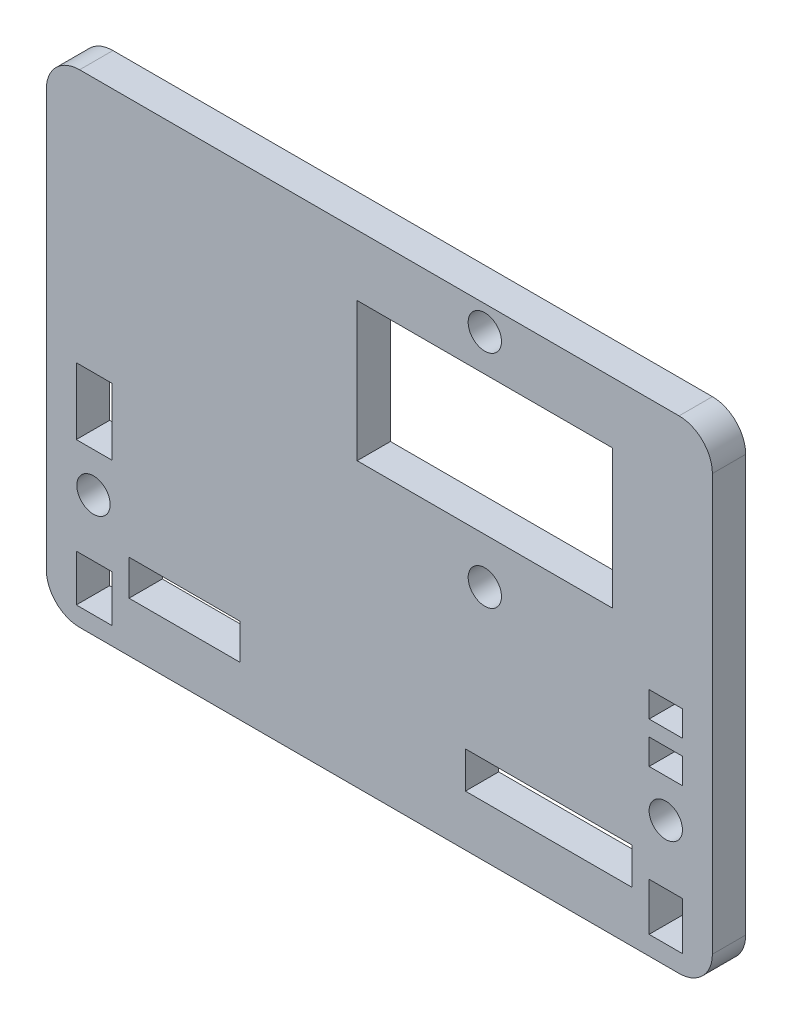
from build123d import *

# Parameters (mm, degrees)
ESQUISSE1_R               = 1.5
ESQUISSE1_W               = 23
ESQUISSE1_H               = 12.5
ESQUISSE1_W_2             = 3.2
ESQUISSE1_H_2             = 6
ESQUISSE1_H_3             = 4.2
ESQUISSE1_W_3             = 10
ESQUISSE1_H_4             = 3.2
ESQUISSE1_W_4             = 15
ESQUISSE1_H_5             = 3.3
ESQUISSE1_W_5             = 3
ESQUISSE1_H_6             = 4.3
ESQUISSE1_H_7             = 2.3
T_LE_DE_BASE_PLI_E1_DEPTH = 3


# Sheet-metal steps are written as plain solids
with BuildPart() as part:
    # Esquisse1 → Tôle de base pliée1 (new body)
    with BuildSketch(Plane.XY):
        with BuildLine():
            Line((-822.16567012, 1708.277520055), (-768.16567012, 1708.277520055))
            ThreePointArc((-768.16567012, 1708.277520055), (-766.044349777, 1707.398840398), (-765.16567012, 1705.277520055))
            Line((-765.16567012, 1705.277520055), (-765.16567012, 1667.777520055))
            ThreePointArc((-765.16567012, 1667.777520055), (-766.044349777, 1665.656199711), (-768.16567012, 1664.777520055))
            Line((-768.16567012, 1664.777520055), (-822.16567012, 1664.777520055))
            ThreePointArc((-822.16567012, 1664.777520055), (-824.286990464, 1665.656199711), (-825.16567012, 1667.777520055))
            Line((-825.16567012, 1667.777520055), (-825.16567012, 1705.277520055))
            ThreePointArc((-825.16567012, 1705.277520055), (-824.286990464, 1707.398840398), (-822.16567012, 1708.277520055))
        make_face()
        with Locations((-785.66567012, 1706.077520055)):
            Circle(ESQUISSE1_R, mode=Mode.SUBTRACT)
        with Locations((-785.66567012, 1686.177520055)):
            Circle(ESQUISSE1_R, mode=Mode.SUBTRACT)
        with Locations((-820.91567012, 1675.727520055)):
            Circle(ESQUISSE1_R, mode=Mode.SUBTRACT)
        with Locations((-769.36567012, 1676.127520055)):
            Circle(ESQUISSE1_R, mode=Mode.SUBTRACT)
        with Locations((-785.66567012, 1696.527520055)):
            Rectangle(ESQUISSE1_W, ESQUISSE1_H, mode=Mode.SUBTRACT)
        with Locations((-820.86567012, 1682.277520055)):
            Rectangle(ESQUISSE1_W_2, ESQUISSE1_H_2, mode=Mode.SUBTRACT)
        with Locations((-820.86567012, 1668.477520055)):
            Rectangle(ESQUISSE1_W_2, ESQUISSE1_H_3, mode=Mode.SUBTRACT)
        with Locations((-812.71567012, 1670.877520055)):
            Rectangle(ESQUISSE1_W_3, ESQUISSE1_H_4, mode=Mode.SUBTRACT)
        with Locations((-779.91567012, 1671.027520055)):
            Rectangle(ESQUISSE1_W_4, ESQUISSE1_H_5, mode=Mode.SUBTRACT)
        with Locations((-769.36567012, 1668.627520055)):
            Rectangle(ESQUISSE1_W_5, ESQUISSE1_H_6, mode=Mode.SUBTRACT)
        with Locations((-769.36567012, 1680.727520055)):
            Rectangle(ESQUISSE1_W_5, ESQUISSE1_H_7, mode=Mode.SUBTRACT)
        with Locations((-769.36567012, 1684.427520055)):
            Rectangle(ESQUISSE1_W_5, ESQUISSE1_H_7, mode=Mode.SUBTRACT)
    extrude(amount=-T_LE_DE_BASE_PLI_E1_DEPTH)


solid = part.part
